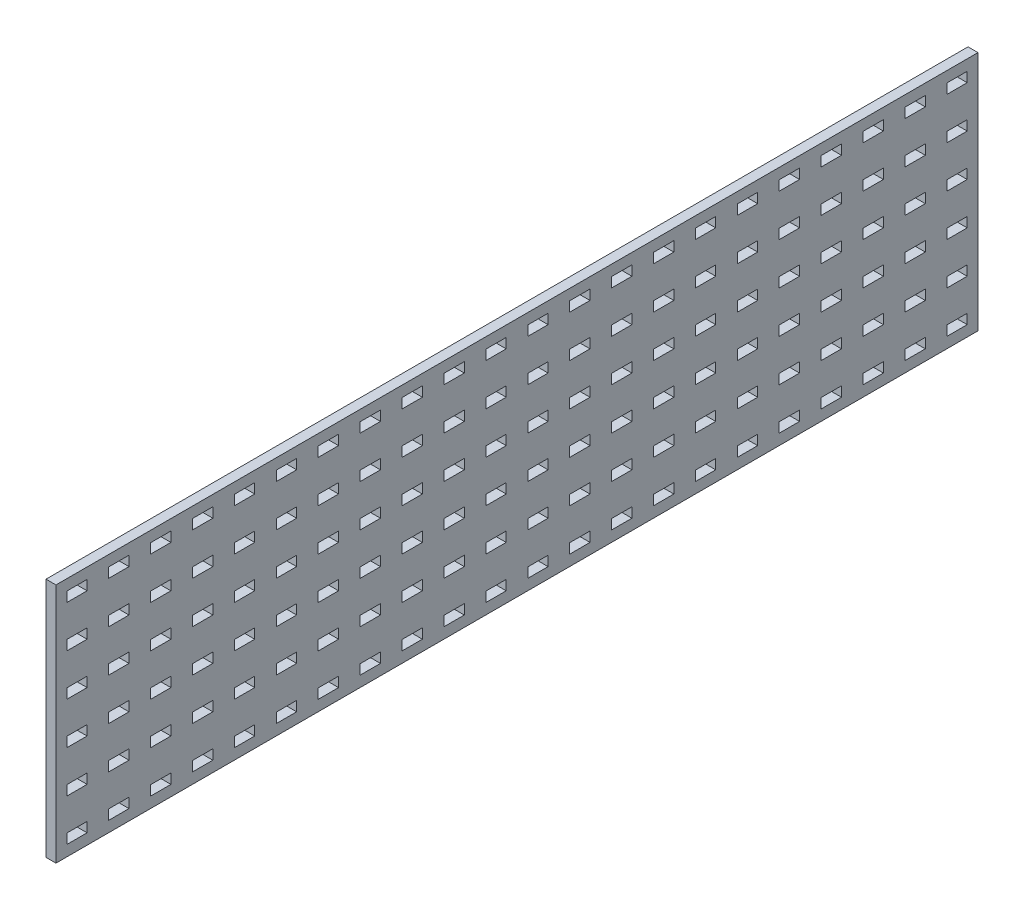
from build123d import *

# Parameters (mm, degrees)
SKETCH1_W           = 558.8
SKETCH1_H           = 146.05
BOSS_EXTRUDE1_DEPTH = 3.0226
SKETCH2_W           = 12.319
SKETCH2_H           = 6
CUT_EXTRUDE1_DEPTH  = 289.84867157


with BuildPart() as part:
    # Sketch1 → Boss-Extrude1 (new, symmetric)
    with BuildSketch(Plane(origin=(0, 0, 0), x_dir=(0, 0, -1), z_dir=(1, 0, 0))):
        Rectangle(SKETCH1_W, SKETCH1_H)
    extrude(amount=BOSS_EXTRUDE1_DEPTH, both=True)

    # Sketch2 → Cut-Extrude1 (cut, through all)
    with BuildSketch(Plane(origin=(3.0226, 0, 0), x_dir=(0, 0, -1), z_dir=(1, 0, 0))):
        with Locations((266.7, -63.5)):
            Rectangle(SKETCH2_W, SKETCH2_H)
        with Locations((241.3, -63.5)):
            Rectangle(SKETCH2_W, SKETCH2_H)
        with Locations((215.9, -63.5)):
            Rectangle(SKETCH2_W, SKETCH2_H)
        with Locations((190.5, -63.5)):
            Rectangle(SKETCH2_W, SKETCH2_H)
        with Locations((165.1, -63.5)):
            Rectangle(SKETCH2_W, SKETCH2_H)
        with Locations((139.7, -63.5)):
            Rectangle(SKETCH2_W, SKETCH2_H)
        with Locations((114.3, -63.5)):
            Rectangle(SKETCH2_W, SKETCH2_H)
        with Locations((88.9, -63.5)):
            Rectangle(SKETCH2_W, SKETCH2_H)
        with Locations((63.5, -63.5)):
            Rectangle(SKETCH2_W, SKETCH2_H)
        with Locations((38.1, -63.5)):
            Rectangle(SKETCH2_W, SKETCH2_H)
        with Locations((12.7, -63.5)):
            Rectangle(SKETCH2_W, SKETCH2_H)
        with Locations((-12.7, -63.5)):
            Rectangle(SKETCH2_W, SKETCH2_H)
        with Locations((-38.1, -63.5)):
            Rectangle(SKETCH2_W, SKETCH2_H)
        with Locations((-63.5, -63.5)):
            Rectangle(SKETCH2_W, SKETCH2_H)
        with Locations((-88.9, -63.5)):
            Rectangle(SKETCH2_W, SKETCH2_H)
        with Locations((-114.3, -63.5)):
            Rectangle(SKETCH2_W, SKETCH2_H)
        with Locations((-139.7, -63.5)):
            Rectangle(SKETCH2_W, SKETCH2_H)
        with Locations((-165.1, -63.5)):
            Rectangle(SKETCH2_W, SKETCH2_H)
        with Locations((-190.5, -63.5)):
            Rectangle(SKETCH2_W, SKETCH2_H)
        with Locations((-215.9, -63.5)):
            Rectangle(SKETCH2_W, SKETCH2_H)
        with Locations((-241.3, -63.5)):
            Rectangle(SKETCH2_W, SKETCH2_H)
        with Locations((-266.7, -63.5)):
            Rectangle(SKETCH2_W, SKETCH2_H)
        with Locations((241.3, -38.1)):
            Rectangle(SKETCH2_W, SKETCH2_H)
        with Locations((215.9, -38.1)):
            Rectangle(SKETCH2_W, SKETCH2_H)
        with Locations((190.5, -38.1)):
            Rectangle(SKETCH2_W, SKETCH2_H)
        with Locations((165.1, -38.1)):
            Rectangle(SKETCH2_W, SKETCH2_H)
        with Locations((139.7, -38.1)):
            Rectangle(SKETCH2_W, SKETCH2_H)
        with Locations((114.3, -38.1)):
            Rectangle(SKETCH2_W, SKETCH2_H)
        with Locations((88.9, -38.1)):
            Rectangle(SKETCH2_W, SKETCH2_H)
        with Locations((63.5, -38.1)):
            Rectangle(SKETCH2_W, SKETCH2_H)
        with Locations((38.1, -38.1)):
            Rectangle(SKETCH2_W, SKETCH2_H)
        with Locations((12.7, -38.1)):
            Rectangle(SKETCH2_W, SKETCH2_H)
        with Locations((-12.7, -38.1)):
            Rectangle(SKETCH2_W, SKETCH2_H)
        with Locations((-38.1, -38.1)):
            Rectangle(SKETCH2_W, SKETCH2_H)
        with Locations((-63.5, -38.1)):
            Rectangle(SKETCH2_W, SKETCH2_H)
        with Locations((-88.9, -38.1)):
            Rectangle(SKETCH2_W, SKETCH2_H)
        with Locations((-114.3, -38.1)):
            Rectangle(SKETCH2_W, SKETCH2_H)
        with Locations((-139.7, -38.1)):
            Rectangle(SKETCH2_W, SKETCH2_H)
        with Locations((-165.1, -38.1)):
            Rectangle(SKETCH2_W, SKETCH2_H)
        with Locations((-190.5, -38.1)):
            Rectangle(SKETCH2_W, SKETCH2_H)
        with Locations((-215.9, -38.1)):
            Rectangle(SKETCH2_W, SKETCH2_H)
        with Locations((-241.3, -38.1)):
            Rectangle(SKETCH2_W, SKETCH2_H)
        with Locations((-266.7, -38.1)):
            Rectangle(SKETCH2_W, SKETCH2_H)
        with Locations((241.3, -12.7)):
            Rectangle(SKETCH2_W, SKETCH2_H)
        with Locations((215.9, -12.7)):
            Rectangle(SKETCH2_W, SKETCH2_H)
        with Locations((190.5, -12.7)):
            Rectangle(SKETCH2_W, SKETCH2_H)
        with Locations((165.1, -12.7)):
            Rectangle(SKETCH2_W, SKETCH2_H)
        with Locations((139.7, -12.7)):
            Rectangle(SKETCH2_W, SKETCH2_H)
        with Locations((114.3, -12.7)):
            Rectangle(SKETCH2_W, SKETCH2_H)
        with Locations((88.9, -12.7)):
            Rectangle(SKETCH2_W, SKETCH2_H)
        with Locations((63.5, -12.7)):
            Rectangle(SKETCH2_W, SKETCH2_H)
        with Locations((38.1, -12.7)):
            Rectangle(SKETCH2_W, SKETCH2_H)
        with Locations((12.7, -12.7)):
            Rectangle(SKETCH2_W, SKETCH2_H)
        with Locations((-12.7, -12.7)):
            Rectangle(SKETCH2_W, SKETCH2_H)
        with Locations((-38.1, -12.7)):
            Rectangle(SKETCH2_W, SKETCH2_H)
        with Locations((-63.5, -12.7)):
            Rectangle(SKETCH2_W, SKETCH2_H)
        with Locations((-88.9, -12.7)):
            Rectangle(SKETCH2_W, SKETCH2_H)
        with Locations((-114.3, -12.7)):
            Rectangle(SKETCH2_W, SKETCH2_H)
        with Locations((-139.7, -12.7)):
            Rectangle(SKETCH2_W, SKETCH2_H)
        with Locations((-165.1, -12.7)):
            Rectangle(SKETCH2_W, SKETCH2_H)
        with Locations((-190.5, -12.7)):
            Rectangle(SKETCH2_W, SKETCH2_H)
        with Locations((-215.9, -12.7)):
            Rectangle(SKETCH2_W, SKETCH2_H)
        with Locations((-241.3, -12.7)):
            Rectangle(SKETCH2_W, SKETCH2_H)
        with Locations((-266.7, -12.7)):
            Rectangle(SKETCH2_W, SKETCH2_H)
        with Locations((241.3, 12.7)):
            Rectangle(SKETCH2_W, SKETCH2_H)
        with Locations((215.9, 12.7)):
            Rectangle(SKETCH2_W, SKETCH2_H)
        with Locations((190.5, 12.7)):
            Rectangle(SKETCH2_W, SKETCH2_H)
        with Locations((165.1, 12.7)):
            Rectangle(SKETCH2_W, SKETCH2_H)
        with Locations((139.7, 12.7)):
            Rectangle(SKETCH2_W, SKETCH2_H)
        with Locations((114.3, 12.7)):
            Rectangle(SKETCH2_W, SKETCH2_H)
        with Locations((88.9, 12.7)):
            Rectangle(SKETCH2_W, SKETCH2_H)
        with Locations((63.5, 12.7)):
            Rectangle(SKETCH2_W, SKETCH2_H)
        with Locations((38.1, 12.7)):
            Rectangle(SKETCH2_W, SKETCH2_H)
        with Locations((12.7, 12.7)):
            Rectangle(SKETCH2_W, SKETCH2_H)
        with Locations((-12.7, 12.7)):
            Rectangle(SKETCH2_W, SKETCH2_H)
        with Locations((-38.1, 12.7)):
            Rectangle(SKETCH2_W, SKETCH2_H)
        with Locations((-63.5, 12.7)):
            Rectangle(SKETCH2_W, SKETCH2_H)
        with Locations((-88.9, 12.7)):
            Rectangle(SKETCH2_W, SKETCH2_H)
        with Locations((-114.3, 12.7)):
            Rectangle(SKETCH2_W, SKETCH2_H)
        with Locations((-139.7, 12.7)):
            Rectangle(SKETCH2_W, SKETCH2_H)
        with Locations((-165.1, 12.7)):
            Rectangle(SKETCH2_W, SKETCH2_H)
        with Locations((-190.5, 12.7)):
            Rectangle(SKETCH2_W, SKETCH2_H)
        with Locations((-215.9, 12.7)):
            Rectangle(SKETCH2_W, SKETCH2_H)
        with Locations((-241.3, 12.7)):
            Rectangle(SKETCH2_W, SKETCH2_H)
        with Locations((-266.7, 12.7)):
            Rectangle(SKETCH2_W, SKETCH2_H)
        with Locations((241.3, 38.1)):
            Rectangle(SKETCH2_W, SKETCH2_H)
        with Locations((215.9, 38.1)):
            Rectangle(SKETCH2_W, SKETCH2_H)
        with Locations((190.5, 38.1)):
            Rectangle(SKETCH2_W, SKETCH2_H)
        with Locations((165.1, 38.1)):
            Rectangle(SKETCH2_W, SKETCH2_H)
        with Locations((139.7, 38.1)):
            Rectangle(SKETCH2_W, SKETCH2_H)
        with Locations((114.3, 38.1)):
            Rectangle(SKETCH2_W, SKETCH2_H)
        with Locations((88.9, 38.1)):
            Rectangle(SKETCH2_W, SKETCH2_H)
        with Locations((63.5, 38.1)):
            Rectangle(SKETCH2_W, SKETCH2_H)
        with Locations((38.1, 38.1)):
            Rectangle(SKETCH2_W, SKETCH2_H)
        with Locations((12.7, 38.1)):
            Rectangle(SKETCH2_W, SKETCH2_H)
        with Locations((-12.7, 38.1)):
            Rectangle(SKETCH2_W, SKETCH2_H)
        with Locations((-38.1, 38.1)):
            Rectangle(SKETCH2_W, SKETCH2_H)
        with Locations((-63.5, 38.1)):
            Rectangle(SKETCH2_W, SKETCH2_H)
        with Locations((-88.9, 38.1)):
            Rectangle(SKETCH2_W, SKETCH2_H)
        with Locations((-114.3, 38.1)):
            Rectangle(SKETCH2_W, SKETCH2_H)
        with Locations((-139.7, 38.1)):
            Rectangle(SKETCH2_W, SKETCH2_H)
        with Locations((-165.1, 38.1)):
            Rectangle(SKETCH2_W, SKETCH2_H)
        with Locations((-190.5, 38.1)):
            Rectangle(SKETCH2_W, SKETCH2_H)
        with Locations((-215.9, 38.1)):
            Rectangle(SKETCH2_W, SKETCH2_H)
        with Locations((-241.3, 38.1)):
            Rectangle(SKETCH2_W, SKETCH2_H)
        with Locations((-266.7, 38.1)):
            Rectangle(SKETCH2_W, SKETCH2_H)
        with Locations((241.3, 63.5)):
            Rectangle(SKETCH2_W, SKETCH2_H)
        with Locations((215.9, 63.5)):
            Rectangle(SKETCH2_W, SKETCH2_H)
        with Locations((190.5, 63.5)):
            Rectangle(SKETCH2_W, SKETCH2_H)
        with Locations((165.1, 63.5)):
            Rectangle(SKETCH2_W, SKETCH2_H)
        with Locations((139.7, 63.5)):
            Rectangle(SKETCH2_W, SKETCH2_H)
        with Locations((114.3, 63.5)):
            Rectangle(SKETCH2_W, SKETCH2_H)
        with Locations((88.9, 63.5)):
            Rectangle(SKETCH2_W, SKETCH2_H)
        with Locations((63.5, 63.5)):
            Rectangle(SKETCH2_W, SKETCH2_H)
        with Locations((38.1, 63.5)):
            Rectangle(SKETCH2_W, SKETCH2_H)
        with Locations((12.7, 63.5)):
            Rectangle(SKETCH2_W, SKETCH2_H)
        with Locations((-12.7, 63.5)):
            Rectangle(SKETCH2_W, SKETCH2_H)
        with Locations((-38.1, 63.5)):
            Rectangle(SKETCH2_W, SKETCH2_H)
        with Locations((-63.5, 63.5)):
            Rectangle(SKETCH2_W, SKETCH2_H)
        with Locations((-88.9, 63.5)):
            Rectangle(SKETCH2_W, SKETCH2_H)
        with Locations((-114.3, 63.5)):
            Rectangle(SKETCH2_W, SKETCH2_H)
        with Locations((-139.7, 63.5)):
            Rectangle(SKETCH2_W, SKETCH2_H)
        with Locations((-165.1, 63.5)):
            Rectangle(SKETCH2_W, SKETCH2_H)
        with Locations((-190.5, 63.5)):
            Rectangle(SKETCH2_W, SKETCH2_H)
        with Locations((-215.9, 63.5)):
            Rectangle(SKETCH2_W, SKETCH2_H)
        with Locations((-241.3, 63.5)):
            Rectangle(SKETCH2_W, SKETCH2_H)
        with Locations((-266.7, 63.5)):
            Rectangle(SKETCH2_W, SKETCH2_H)
        with Locations((241.3, 88.9)):
            Rectangle(SKETCH2_W, SKETCH2_H)
        with Locations((215.9, 88.9)):
            Rectangle(SKETCH2_W, SKETCH2_H)
        with Locations((190.5, 88.9)):
            Rectangle(SKETCH2_W, SKETCH2_H)
        with Locations((165.1, 88.9)):
            Rectangle(SKETCH2_W, SKETCH2_H)
        with Locations((139.7, 88.9)):
            Rectangle(SKETCH2_W, SKETCH2_H)
        with Locations((114.3, 88.9)):
            Rectangle(SKETCH2_W, SKETCH2_H)
        with Locations((88.9, 88.9)):
            Rectangle(SKETCH2_W, SKETCH2_H)
        with Locations((63.5, 88.9)):
            Rectangle(SKETCH2_W, SKETCH2_H)
        with Locations((38.1, 88.9)):
            Rectangle(SKETCH2_W, SKETCH2_H)
        with Locations((12.7, 88.9)):
            Rectangle(SKETCH2_W, SKETCH2_H)
        with Locations((-12.7, 88.9)):
            Rectangle(SKETCH2_W, SKETCH2_H)
        with Locations((-38.1, 88.9)):
            Rectangle(SKETCH2_W, SKETCH2_H)
        with Locations((-63.5, 88.9)):
            Rectangle(SKETCH2_W, SKETCH2_H)
        with Locations((-88.9, 88.9)):
            Rectangle(SKETCH2_W, SKETCH2_H)
        with Locations((-114.3, 88.9)):
            Rectangle(SKETCH2_W, SKETCH2_H)
        with Locations((-139.7, 88.9)):
            Rectangle(SKETCH2_W, SKETCH2_H)
        with Locations((-165.1, 88.9)):
            Rectangle(SKETCH2_W, SKETCH2_H)
        with Locations((-190.5, 88.9)):
            Rectangle(SKETCH2_W, SKETCH2_H)
        with Locations((-215.9, 88.9)):
            Rectangle(SKETCH2_W, SKETCH2_H)
        with Locations((-241.3, 88.9)):
            Rectangle(SKETCH2_W, SKETCH2_H)
        with Locations((-266.7, 88.9)):
            Rectangle(SKETCH2_W, SKETCH2_H)
        with Locations((241.3, 114.3)):
            Rectangle(SKETCH2_W, SKETCH2_H)
        with Locations((215.9, 114.3)):
            Rectangle(SKETCH2_W, SKETCH2_H)
        with Locations((190.5, 114.3)):
            Rectangle(SKETCH2_W, SKETCH2_H)
        with Locations((165.1, 114.3)):
            Rectangle(SKETCH2_W, SKETCH2_H)
        with Locations((139.7, 114.3)):
            Rectangle(SKETCH2_W, SKETCH2_H)
        with Locations((114.3, 114.3)):
            Rectangle(SKETCH2_W, SKETCH2_H)
        with Locations((88.9, 114.3)):
            Rectangle(SKETCH2_W, SKETCH2_H)
        with Locations((63.5, 114.3)):
            Rectangle(SKETCH2_W, SKETCH2_H)
        with Locations((38.1, 114.3)):
            Rectangle(SKETCH2_W, SKETCH2_H)
        with Locations((12.7, 114.3)):
            Rectangle(SKETCH2_W, SKETCH2_H)
        with Locations((-12.7, 114.3)):
            Rectangle(SKETCH2_W, SKETCH2_H)
        with Locations((-38.1, 114.3)):
            Rectangle(SKETCH2_W, SKETCH2_H)
        with Locations((-63.5, 114.3)):
            Rectangle(SKETCH2_W, SKETCH2_H)
        with Locations((-88.9, 114.3)):
            Rectangle(SKETCH2_W, SKETCH2_H)
        with Locations((-114.3, 114.3)):
            Rectangle(SKETCH2_W, SKETCH2_H)
        with Locations((-139.7, 114.3)):
            Rectangle(SKETCH2_W, SKETCH2_H)
        with Locations((-165.1, 114.3)):
            Rectangle(SKETCH2_W, SKETCH2_H)
        with Locations((-190.5, 114.3)):
            Rectangle(SKETCH2_W, SKETCH2_H)
        with Locations((-215.9, 114.3)):
            Rectangle(SKETCH2_W, SKETCH2_H)
        with Locations((-241.3, 114.3)):
            Rectangle(SKETCH2_W, SKETCH2_H)
        with Locations((-266.7, 114.3)):
            Rectangle(SKETCH2_W, SKETCH2_H)
        with Locations((241.3, 139.7)):
            Rectangle(SKETCH2_W, SKETCH2_H)
        with Locations((215.9, 139.7)):
            Rectangle(SKETCH2_W, SKETCH2_H)
        with Locations((190.5, 139.7)):
            Rectangle(SKETCH2_W, SKETCH2_H)
        with Locations((165.1, 139.7)):
            Rectangle(SKETCH2_W, SKETCH2_H)
        with Locations((139.7, 139.7)):
            Rectangle(SKETCH2_W, SKETCH2_H)
        with Locations((114.3, 139.7)):
            Rectangle(SKETCH2_W, SKETCH2_H)
        with Locations((88.9, 139.7)):
            Rectangle(SKETCH2_W, SKETCH2_H)
        with Locations((63.5, 139.7)):
            Rectangle(SKETCH2_W, SKETCH2_H)
        with Locations((38.1, 139.7)):
            Rectangle(SKETCH2_W, SKETCH2_H)
        with Locations((12.7, 139.7)):
            Rectangle(SKETCH2_W, SKETCH2_H)
        with Locations((-12.7, 139.7)):
            Rectangle(SKETCH2_W, SKETCH2_H)
        with Locations((-38.1, 139.7)):
            Rectangle(SKETCH2_W, SKETCH2_H)
        with Locations((-63.5, 139.7)):
            Rectangle(SKETCH2_W, SKETCH2_H)
        with Locations((-88.9, 139.7)):
            Rectangle(SKETCH2_W, SKETCH2_H)
        with Locations((-114.3, 139.7)):
            Rectangle(SKETCH2_W, SKETCH2_H)
        with Locations((-139.7, 139.7)):
            Rectangle(SKETCH2_W, SKETCH2_H)
        with Locations((-165.1, 139.7)):
            Rectangle(SKETCH2_W, SKETCH2_H)
        with Locations((-190.5, 139.7)):
            Rectangle(SKETCH2_W, SKETCH2_H)
        with Locations((-215.9, 139.7)):
            Rectangle(SKETCH2_W, SKETCH2_H)
        with Locations((-241.3, 139.7)):
            Rectangle(SKETCH2_W, SKETCH2_H)
        with Locations((-266.7, 139.7)):
            Rectangle(SKETCH2_W, SKETCH2_H)
        with Locations((241.3, 165.1)):
            Rectangle(SKETCH2_W, SKETCH2_H)
        with Locations((215.9, 165.1)):
            Rectangle(SKETCH2_W, SKETCH2_H)
        with Locations((190.5, 165.1)):
            Rectangle(SKETCH2_W, SKETCH2_H)
        with Locations((165.1, 165.1)):
            Rectangle(SKETCH2_W, SKETCH2_H)
        with Locations((139.7, 165.1)):
            Rectangle(SKETCH2_W, SKETCH2_H)
        with Locations((114.3, 165.1)):
            Rectangle(SKETCH2_W, SKETCH2_H)
        with Locations((88.9, 165.1)):
            Rectangle(SKETCH2_W, SKETCH2_H)
        with Locations((63.5, 165.1)):
            Rectangle(SKETCH2_W, SKETCH2_H)
        with Locations((38.1, 165.1)):
            Rectangle(SKETCH2_W, SKETCH2_H)
        with Locations((12.7, 165.1)):
            Rectangle(SKETCH2_W, SKETCH2_H)
        with Locations((-12.7, 165.1)):
            Rectangle(SKETCH2_W, SKETCH2_H)
        with Locations((-38.1, 165.1)):
            Rectangle(SKETCH2_W, SKETCH2_H)
        with Locations((-63.5, 165.1)):
            Rectangle(SKETCH2_W, SKETCH2_H)
        with Locations((-88.9, 165.1)):
            Rectangle(SKETCH2_W, SKETCH2_H)
        with Locations((-114.3, 165.1)):
            Rectangle(SKETCH2_W, SKETCH2_H)
        with Locations((-139.7, 165.1)):
            Rectangle(SKETCH2_W, SKETCH2_H)
        with Locations((-165.1, 165.1)):
            Rectangle(SKETCH2_W, SKETCH2_H)
        with Locations((-190.5, 165.1)):
            Rectangle(SKETCH2_W, SKETCH2_H)
        with Locations((-215.9, 165.1)):
            Rectangle(SKETCH2_W, SKETCH2_H)
        with Locations((-241.3, 165.1)):
            Rectangle(SKETCH2_W, SKETCH2_H)
        with Locations((-266.7, 165.1)):
            Rectangle(SKETCH2_W, SKETCH2_H)
        with Locations((266.7, -38.1)):
            Rectangle(SKETCH2_W, SKETCH2_H)
        with Locations((266.7, -12.7)):
            Rectangle(SKETCH2_W, SKETCH2_H)
        with Locations((266.7, 12.7)):
            Rectangle(SKETCH2_W, SKETCH2_H)
        with Locations((266.7, 38.1)):
            Rectangle(SKETCH2_W, SKETCH2_H)
        with Locations((266.7, 63.5)):
            Rectangle(SKETCH2_W, SKETCH2_H)
        with Locations((266.7, 88.9)):
            Rectangle(SKETCH2_W, SKETCH2_H)
        with Locations((266.7, 114.3)):
            Rectangle(SKETCH2_W, SKETCH2_H)
        with Locations((266.7, 139.7)):
            Rectangle(SKETCH2_W, SKETCH2_H)
        with Locations((266.7, 165.1)):
            Rectangle(SKETCH2_W, SKETCH2_H)
    extrude(amount=-CUT_EXTRUDE1_DEPTH, mode=Mode.SUBTRACT)


solid = part.part
